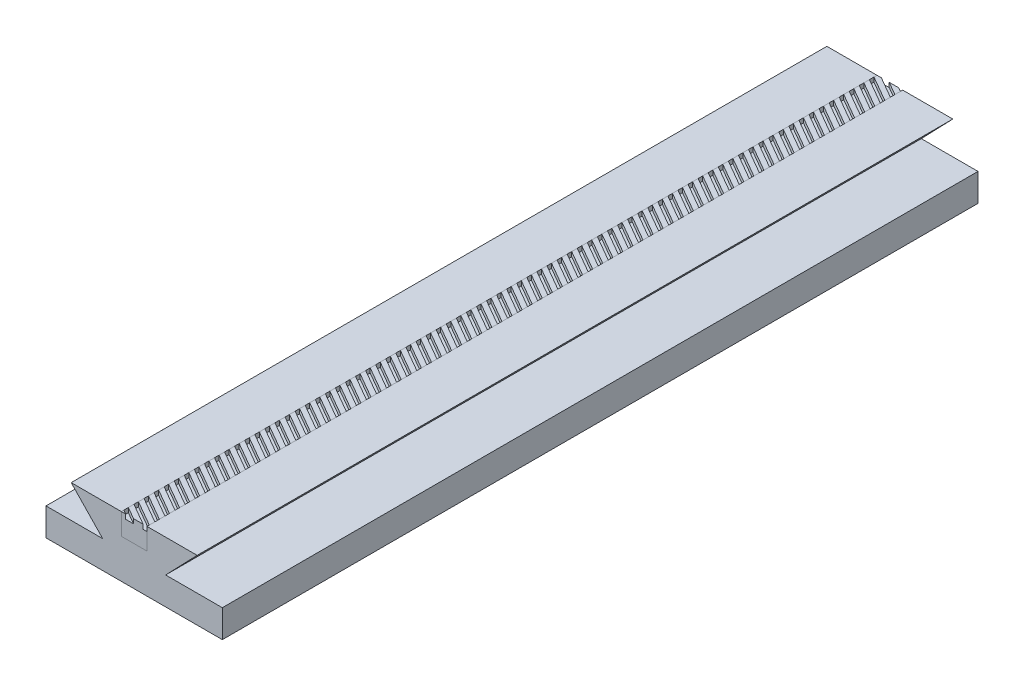
from build123d import *

# Parameters (mm, degrees)
EXTRUDE_1_DEPTH             = 150
CUT_EXTRUDE_1_DEPTH         = 303.986798392
CUT_EXTRUDE_1_DEPTH_BACK    = 303.986798392
SKETCH_2_W                  = 10.2
SKETCH_2_H                  = 8.5
SKETCH_3_W                  = 10.2
SKETCH_3_H                  = 8.5
EXTRUDE_2_DEPTH             = 300
CUT_EXTRUDE_2_DEPTH         = 1.8
PATTERN_START               = 22.2
PATTERN_LINEAR_1_DEPTH      = 1.8
HOLE_WIZARD_1_AT_2_COUNT    = 2
HOLE_WIZARD_1_AT_2_PITCH    = 115
HOLE_WIZARD_1_AT_3_COUNT    = 2
HOLE_WIZARD_1_AT_3_PITCH    = 230
HOLE_WIZARD_M5_1_AT_2_COUNT = 2
HOLE_WIZARD_M5_1_AT_2_PITCH = 25
HOLE_WIZARD_M5_1_AT_3_COUNT = 2
HOLE_WIZARD_M5_1_AT_3_PITCH = 50


# Read off the part's stored shape, not the designer's step: 阵列(线性)1
with BuildPart() as part:
    # 草图1 → 凸台-拉伸1 (new, symmetric)
    with BuildSketch(Plane.XY):
        Polygon((35, 0), (-35, 0), (-35, 11), (-12.5, 11), (-25, 24), (25, 24), (12.5, 11), (35, 11), align=None)
    extrude(amount=EXTRUDE_1_DEPTH, both=True)

    # 草图2 → 切除-拉伸1 (cut, two sides: drawn at the far end of the back side and taken through both)
    with BuildSketch(Plane.XY.offset(150).offset(-CUT_EXTRUDE_1_DEPTH_BACK)):
        with Locations((0, 19.75)):
            Rectangle(SKETCH_2_W, SKETCH_2_H)
    extrude(amount=CUT_EXTRUDE_1_DEPTH + CUT_EXTRUDE_1_DEPTH_BACK, mode=Mode.SUBTRACT)


with BuildPart() as body_2:
    # 草图3 → 凸台-拉伸2 (new body)
    with BuildSketch(Plane.XY.offset(150)):
        with Locations((0, 19.75)):
            Rectangle(SKETCH_3_W, SKETCH_3_H)
    extrude(amount=-EXTRUDE_2_DEPTH)

    # 草图4 → 切除-拉伸2 (cut)
    with BuildSketch(Plane(origin=(0, 24, 0), x_dir=(1, 0, 0), z_dir=(0, 1, 0))):
        Polygon((-5.1, 156.8), (5.1, 150.911027254), (5.1, 149.111027254), (-5.1, 155), align=None)
    extrude(amount=-CUT_EXTRUDE_2_DEPTH, mode=Mode.SUBTRACT)

    # 阵列(线性)1 outline → 阵列(线性)1 (cut)
    with BuildSketch(Plane(origin=(0, 0, 0), x_dir=(1, 0, 0), z_dir=(0, 1, 0)).offset(PATTERN_START)):
        Polygon((5.1, 145.111027254), (5.1, 146.911027254), (-0.250257739, 150), (-3.367949192, 150), align=None)
        Polygon((5.1, 141.111027254), (5.1, 142.911027254), (-5.1, 148.8), (-5.1, 147), align=None)
        Polygon((5.1, 137.111027254), (5.1, 138.911027254), (-5.1, 144.8), (-5.1, 143), align=None)
        Polygon((5.1, 133.111027254), (5.1, 134.911027254), (-5.1, 140.8), (-5.1, 139), align=None)
        Polygon((5.1, 129.111027254), (5.1, 130.911027254), (-5.1, 136.8), (-5.1, 135), align=None)
        Polygon((5.1, 125.111027254), (5.1, 126.911027254), (-5.1, 132.8), (-5.1, 131), align=None)
        Polygon((5.1, 121.111027254), (5.1, 122.911027254), (-5.1, 128.8), (-5.1, 127), align=None)
        Polygon((5.1, 117.111027254), (5.1, 118.911027254), (-5.1, 124.8), (-5.1, 123), align=None)
        Polygon((5.1, 113.111027254), (5.1, 114.911027254), (-5.1, 120.8), (-5.1, 119), align=None)
        Polygon((5.1, 109.111027254), (5.1, 110.911027254), (-5.1, 116.8), (-5.1, 115), align=None)
        Polygon((5.1, 105.111027254), (5.1, 106.911027254), (-5.1, 112.8), (-5.1, 111), align=None)
        Polygon((5.1, 101.111027254), (5.1, 102.911027254), (-5.1, 108.8), (-5.1, 107), align=None)
        Polygon((5.1, 97.111027254), (5.1, 98.911027254), (-5.1, 104.8), (-5.1, 103), align=None)
        Polygon((5.1, 93.111027254), (5.1, 94.911027254), (-5.1, 100.8), (-5.1, 99), align=None)
        Polygon((5.1, 89.111027254), (5.1, 90.911027254), (-5.1, 96.8), (-5.1, 95), align=None)
        Polygon((5.1, 85.111027254), (5.1, 86.911027254), (-5.1, 92.8), (-5.1, 91), align=None)
        Polygon((5.1, 81.111027254), (5.1, 82.911027254), (-5.1, 88.8), (-5.1, 87), align=None)
        Polygon((5.1, 77.111027254), (5.1, 78.911027254), (-5.1, 84.8), (-5.1, 83), align=None)
        Polygon((5.1, 73.111027254), (5.1, 74.911027254), (-5.1, 80.8), (-5.1, 79), align=None)
        Polygon((5.1, 69.111027254), (5.1, 70.911027254), (-5.1, 76.8), (-5.1, 75), align=None)
        Polygon((5.1, 65.111027254), (5.1, 66.911027254), (-5.1, 72.8), (-5.1, 71), align=None)
        Polygon((5.1, 61.111027254), (5.1, 62.911027254), (-5.1, 68.8), (-5.1, 67), align=None)
        Polygon((5.1, 57.111027254), (5.1, 58.911027254), (-5.1, 64.8), (-5.1, 63), align=None)
        Polygon((5.1, 53.111027254), (5.1, 54.911027254), (-5.1, 60.8), (-5.1, 59), align=None)
        Polygon((5.1, 49.111027254), (5.1, 50.911027254), (-5.1, 56.8), (-5.1, 55), align=None)
        Polygon((5.1, 45.111027254), (5.1, 46.911027254), (-5.1, 52.8), (-5.1, 51), align=None)
        Polygon((5.1, 41.111027254), (5.1, 42.911027254), (-5.1, 48.8), (-5.1, 47), align=None)
        Polygon((5.1, 37.111027254), (5.1, 38.911027254), (-5.1, 44.8), (-5.1, 43), align=None)
        Polygon((5.1, 33.111027254), (5.1, 34.911027254), (-5.1, 40.8), (-5.1, 39), align=None)
        Polygon((5.1, 29.111027254), (5.1, 30.911027254), (-5.1, 36.8), (-5.1, 35), align=None)
        Polygon((5.1, 25.111027254), (5.1, 26.911027254), (-5.1, 32.8), (-5.1, 31), align=None)
        Polygon((5.1, 21.111027254), (5.1, 22.911027254), (-5.1, 28.8), (-5.1, 27), align=None)
        Polygon((5.1, 17.111027254), (5.1, 18.911027254), (-5.1, 24.8), (-5.1, 23), align=None)
        Polygon((5.1, 13.111027254), (5.1, 14.911027254), (-5.1, 20.8), (-5.1, 19), align=None)
        Polygon((5.1, 9.111027254), (5.1, 10.911027254), (-5.1, 16.8), (-5.1, 15), align=None)
        Polygon((5.1, 5.111027254), (5.1, 6.911027254), (-5.1, 12.8), (-5.1, 11), align=None)
        Polygon((5.1, 1.111027254), (5.1, 2.911027254), (-5.1, 8.8), (-5.1, 7), align=None)
        Polygon((5.1, -2.888972746), (5.1, -1.088972746), (-5.1, 4.8), (-5.1, 3), align=None)
        Polygon((5.1, -6.888972746), (5.1, -5.088972746), (-5.1, 0.8), (-5.1, -1), align=None)
        Polygon((5.1, -10.888972746), (5.1, -9.088972746), (-5.1, -3.2), (-5.1, -5), align=None)
        Polygon((5.1, -14.888972746), (5.1, -13.088972746), (-5.1, -7.2), (-5.1, -9), align=None)
        Polygon((5.1, -18.888972746), (5.1, -17.088972746), (-5.1, -11.2), (-5.1, -13), align=None)
        Polygon((5.1, -22.888972746), (5.1, -21.088972746), (-5.1, -15.2), (-5.1, -17), align=None)
        Polygon((5.1, -26.888972746), (5.1, -25.088972746), (-5.1, -19.2), (-5.1, -21), align=None)
        Polygon((5.1, -30.888972746), (5.1, -29.088972746), (-5.1, -23.2), (-5.1, -25), align=None)
        Polygon((5.1, -34.888972746), (5.1, -33.088972746), (-5.1, -27.2), (-5.1, -29), align=None)
        Polygon((5.1, -38.888972746), (5.1, -37.088972746), (-5.1, -31.2), (-5.1, -33), align=None)
        Polygon((5.1, -42.888972746), (5.1, -41.088972746), (-5.1, -35.2), (-5.1, -37), align=None)
        Polygon((5.1, -46.888972746), (5.1, -45.088972746), (-5.1, -39.2), (-5.1, -41), align=None)
        Polygon((5.1, -50.888972746), (5.1, -49.088972746), (-5.1, -43.2), (-5.1, -45), align=None)
        Polygon((5.1, -54.888972746), (5.1, -53.088972746), (-5.1, -47.2), (-5.1, -49), align=None)
        Polygon((5.1, -58.888972746), (5.1, -57.088972746), (-5.1, -51.2), (-5.1, -53), align=None)
        Polygon((5.1, -62.888972746), (5.1, -61.088972746), (-5.1, -55.2), (-5.1, -57), align=None)
        Polygon((5.1, -66.888972746), (5.1, -65.088972746), (-5.1, -59.2), (-5.1, -61), align=None)
        Polygon((5.1, -70.888972746), (5.1, -69.088972746), (-5.1, -63.2), (-5.1, -65), align=None)
        Polygon((5.1, -74.888972746), (5.1, -73.088972746), (-5.1, -67.2), (-5.1, -69), align=None)
        Polygon((5.1, -78.888972746), (5.1, -77.088972746), (-5.1, -71.2), (-5.1, -73), align=None)
        Polygon((5.1, -82.888972746), (5.1, -81.088972746), (-5.1, -75.2), (-5.1, -77), align=None)
        Polygon((5.1, -86.888972746), (5.1, -85.088972746), (-5.1, -79.2), (-5.1, -81), align=None)
        Polygon((5.1, -90.888972746), (5.1, -89.088972746), (-5.1, -83.2), (-5.1, -85), align=None)
        Polygon((5.1, -94.888972746), (5.1, -93.088972746), (-5.1, -87.2), (-5.1, -89), align=None)
        Polygon((5.1, -98.888972746), (5.1, -97.088972746), (-5.1, -91.2), (-5.1, -93), align=None)
        Polygon((5.1, -102.888972746), (5.1, -101.088972746), (-5.1, -95.2), (-5.1, -97), align=None)
        Polygon((5.1, -106.888972746), (5.1, -105.088972746), (-5.1, -99.2), (-5.1, -101), align=None)
        Polygon((5.1, -110.888972746), (5.1, -109.088972746), (-5.1, -103.2), (-5.1, -105), align=None)
        Polygon((5.1, -114.888972746), (5.1, -113.088972746), (-5.1, -107.2), (-5.1, -109), align=None)
        Polygon((5.1, -118.888972746), (5.1, -117.088972746), (-5.1, -111.2), (-5.1, -113), align=None)
        Polygon((5.1, -122.888972746), (5.1, -121.088972746), (-5.1, -115.2), (-5.1, -117), align=None)
        Polygon((5.1, -126.888972746), (5.1, -125.088972746), (-5.1, -119.2), (-5.1, -121), align=None)
        Polygon((5.1, -130.888972746), (5.1, -129.088972746), (-5.1, -123.2), (-5.1, -125), align=None)
        Polygon((5.1, -134.888972746), (5.1, -133.088972746), (-5.1, -127.2), (-5.1, -129), align=None)
        Polygon((5.1, -138.888972746), (5.1, -137.088972746), (-5.1, -131.2), (-5.1, -133), align=None)
        Polygon((5.1, -142.888972746), (5.1, -141.088972746), (-5.1, -135.2), (-5.1, -137), align=None)
        Polygon((5.1, -146.888972746), (5.1, -145.088972746), (-5.1, -139.2), (-5.1, -141), align=None)
        Polygon((5.1, -150), (5.1, -149.088972746), (-5.1, -143.2), (-5.1, -145), (3.560254038, -150), align=None)
        Polygon((-0.250257739, -150), (-5.1, -147.2), (-5.1, -149), (-3.367949192, -150), align=None)
    extrude(amount=PATTERN_LINEAR_1_DEPTH, mode=Mode.SUBTRACT)


with BuildPart() as hole_wizard_1_tool:
    # 草图5 → 打孔尺寸(%根据)内六角圆柱头螺钉的类型1 (revolve)
    with BuildSketch(Plane(origin=(0, 0, -115), x_dir=(0, 0, -1), z_dir=(1, 0, 0))):
        Polygon((0, 0), (0, 16.851936393), (2.25, 15.5), (2.25, 4.6), (4, 4.6), (4, 0), align=None)
    hole_wizard_1 = revolve(axis=Axis((0, -6.35, -115), (0, 1, 0)))


with BuildPart() as part_1:
    add(part.part)

    # 打孔尺寸(%根据)内六角圆柱头螺钉的类型1: cut by hole_wizard_1_tool
    add(hole_wizard_1_tool.part, mode=Mode.SUBTRACT)


with BuildPart() as body_2_1:
    add(body_2.part)

    # 打孔尺寸(%根据)内六角圆柱头螺钉的类型1: cut by hole_wizard_1_tool
    add(hole_wizard_1_tool.part, mode=Mode.SUBTRACT)


with BuildPart() as hole_wizard_1_at_2_tool:
    # 打孔尺寸(%根据)内六角圆柱头螺钉的类型1 at 2: 打孔尺寸(%根据)内六角圆柱头螺钉的类型1 ×2
    with Locations(*[(0, 0, i * HOLE_WIZARD_1_AT_2_PITCH) for i in range(1, HOLE_WIZARD_1_AT_2_COUNT)]):
        add(hole_wizard_1)


with BuildPart() as part_2:
    add(part_1.part)

    # 打孔尺寸(%根据)内六角圆柱头螺钉的类型1 at 2: cut by hole_wizard_1_at_2_tool
    add(hole_wizard_1_at_2_tool.part, mode=Mode.SUBTRACT)


with BuildPart() as body_2_2:
    add(body_2_1.part)

    # 打孔尺寸(%根据)内六角圆柱头螺钉的类型1 at 2: cut by hole_wizard_1_at_2_tool
    add(hole_wizard_1_at_2_tool.part, mode=Mode.SUBTRACT)


with BuildPart() as hole_wizard_1_at_3_tool:
    # 打孔尺寸(%根据)内六角圆柱头螺钉的类型1 at 3: 打孔尺寸(%根据)内六角圆柱头螺钉的类型1 ×2
    with Locations(*[(0, 0, i * HOLE_WIZARD_1_AT_3_PITCH) for i in range(1, HOLE_WIZARD_1_AT_3_COUNT)]):
        add(hole_wizard_1)


with BuildPart() as part_3:
    add(part_2.part)

    # 打孔尺寸(%根据)内六角圆柱头螺钉的类型1 at 3: cut by hole_wizard_1_at_3_tool
    add(hole_wizard_1_at_3_tool.part, mode=Mode.SUBTRACT)

    # 草图7 → M5 螺纹孔1 (revolve, cut)
    with BuildSketch(Plane(origin=(25, 5, -150), x_dir=(0, 1, 0), z_dir=(1, 0, 0))):
        Polygon((0, 0), (0, 13.6618073), (2.1, 12.4), (2.1, 0), align=None)
    hole_wizard_m5_1 = revolve(axis=Axis((25, 5, -156.35), (0, 0, 1)), mode=Mode.SUBTRACT)

    # M5 螺纹孔1 at 2: M5 螺纹孔1 ×2
    with Locations(*[(-i * HOLE_WIZARD_M5_1_AT_2_PITCH, 0, 0) for i in range(1, HOLE_WIZARD_M5_1_AT_2_COUNT)]):
        add(hole_wizard_m5_1, mode=Mode.SUBTRACT)

    # M5 螺纹孔1 at 3: M5 螺纹孔1 ×2
    with Locations(*[(-i * HOLE_WIZARD_M5_1_AT_3_PITCH, 0, 0) for i in range(1, HOLE_WIZARD_M5_1_AT_3_COUNT)]):
        add(hole_wizard_m5_1, mode=Mode.SUBTRACT)


with BuildPart() as body_2_3:
    add(body_2_2.part)

    # 打孔尺寸(%根据)内六角圆柱头螺钉的类型1 at 3: cut by hole_wizard_1_at_3_tool
    add(hole_wizard_1_at_3_tool.part, mode=Mode.SUBTRACT)


solid = Compound([part_3.part, body_2_3.part])
